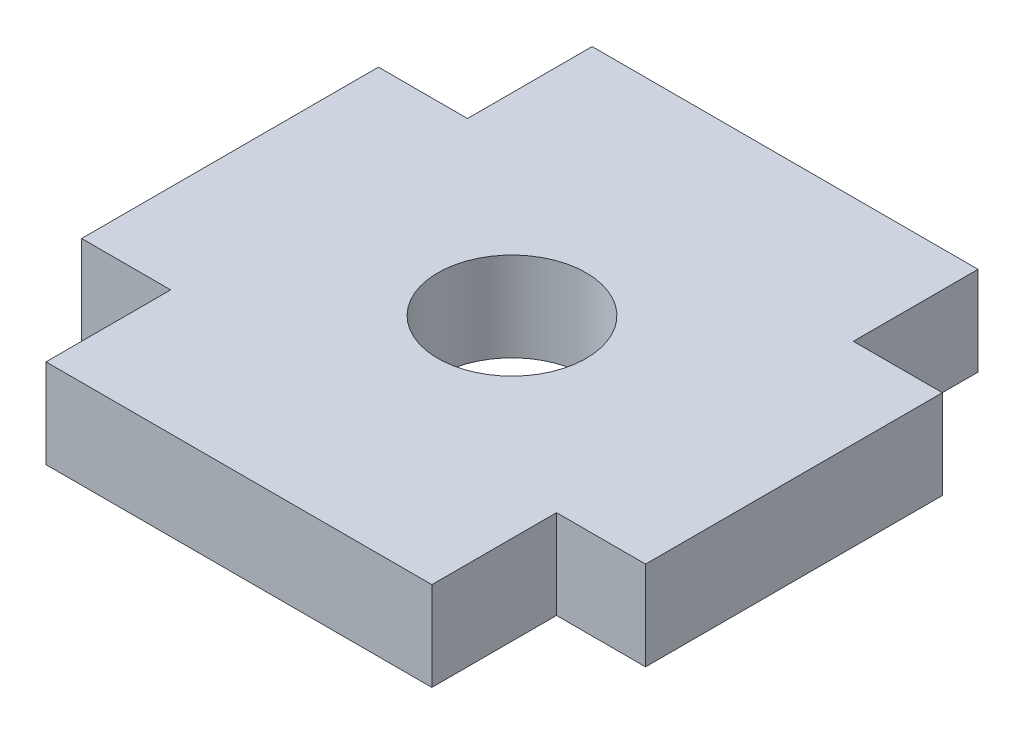
from build123d import *

# Parameters (mm, degrees)
ESBO_O1_R                = 2.5
RESSALTO_EXTRUS_O1_DEPTH = 3


with BuildPart() as part:
    # Esboço1 → Ressalto-extrusão1 (new body)
    with BuildSketch(Plane.XZ.offset(-10)):
        Polygon((-63.5, -9.199919627), (-63.5, -5), (-60.5, -5), (-60.5, 5), (-63.5, 5), (-63.5, 9.199919627), (-76.5, 9.199919627), (-76.5, 5), (-79.5, 5), (-79.5, -5), (-76.5, -5), (-76.5, -9.199919627), align=None)
        with Locations((-70, 0)):
            Circle(ESBO_O1_R, mode=Mode.SUBTRACT)
    extrude(amount=-RESSALTO_EXTRUS_O1_DEPTH)


solid = part.part
